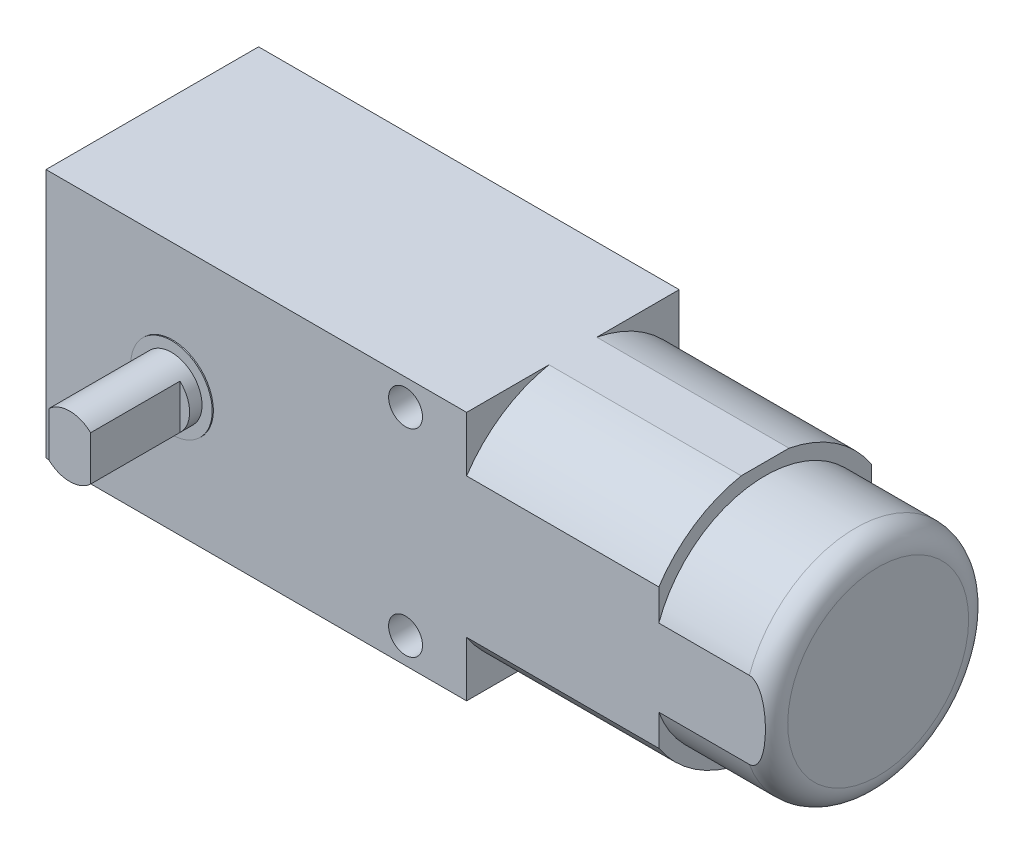
from build123d import *

# Parameters (mm, degrees)
SKETCH_2_W          = 18.8
SKETCH_2_H          = 22.1
EXTRUDE_1_DEPTH     = 64.2
SKETCH_4_R          = 3.6
EXTRUDE_2_DEPTH     = 0.1
SKETCH_5_R          = 2.7
EXTRUDE_3_DEPTH     = 9.1
CUT_EXTRUDE_START   = -7.9
CUT_EXTRUDE_1_DEPTH = 7.9
CUT_EXTRUDE_2_DEPTH = 27
CUT_EXTRUDE_3_DEPTH = 10
FILLET_1_R          = 2
SKETCH_10_R         = 1.5
CUT_EXTRUDE_4_DEPTH = 3


with BuildPart() as part:
    # 草图2 → 凸台-拉伸1 (new body)
    with BuildSketch(Plane(origin=(0, 0, 0), x_dir=(0, 0, -1), z_dir=(1, 0, 0))):
        Rectangle(SKETCH_2_W, SKETCH_2_H)
    extrude(amount=EXTRUDE_1_DEPTH)

    # 草图4 → 凸台-拉伸2 (add)
    with BuildSketch(Plane.XY.offset(9.4)):
        with Locations(Location((11.2, 0, 0), (0, 0, 180))):
            Circle(SKETCH_4_R)
    extrude(amount=EXTRUDE_2_DEPTH)

    # 草图5 → 凸台-拉伸3 (add)
    with BuildSketch(Plane.XY.offset(9.4)):
        with Locations(Location((11.2, 0, 0), (0, 0, 180))):
            Circle(SKETCH_5_R)
    extrude(amount=EXTRUDE_3_DEPTH)

    # 草图6 → 切除-拉伸1 (cut)
    with BuildSketch(Plane.XY.offset(18.5).offset(CUT_EXTRUDE_START)):
        with BuildLine():
            Line((9.35, -1.966596044), (9.35, 1.966596044))
            ThreePointArc((9.35, 1.966596044), (8.5, 0), (9.35, -1.966596044))
        make_face()
        with BuildLine():
            ThreePointArc((13.9, 0), (13.678406746, 1.071214264), (13.05, 1.966596044))
            Line((13.05, 1.966596044), (13.05, -1.966596044))
            ThreePointArc((13.05, -1.966596044), (13.678406746, -1.071214264), (13.9, 0))
        make_face()
    extrude(amount=CUT_EXTRUDE_1_DEPTH, mode=Mode.SUBTRACT)

    # 草图7 → 切除-拉伸2 (cut)
    with BuildSketch(Plane(origin=(64.2, 0, 0), x_dir=(0, 0, -1), z_dir=(1, 0, 0))):
        with BuildLine():
            ThreePointArc((-9.4, 6.180817098), (-6.249642407, 9.354382384), (-2.111871208, 11.05))
            Line((-2.111871208, 11.05), (-9.4, 11.05))
            Line((-9.4, 11.05), (-9.4, 6.180817098))
        make_face()
        with BuildLine():
            ThreePointArc((2.111871208, 11.05), (6.249642407, 9.354382384), (9.4, 6.180817098))
            Line((9.4, 6.180817098), (9.4, 11.05))
            Line((9.4, 11.05), (2.111871208, 11.05))
        make_face()
        with BuildLine():
            Line((2.111871208, -11.05), (9.4, -11.05))
            Line((9.4, -11.05), (9.4, -6.180817098))
            ThreePointArc((9.4, -6.180817098), (6.249642407, -9.354382384), (2.111871208, -11.05))
        make_face()
        with BuildLine():
            Line((-9.4, -11.05), (-2.111871208, -11.05))
            ThreePointArc((-2.111871208, -11.05), (-6.249642407, -9.354382384), (-9.4, -6.180817098))
            Line((-9.4, -6.180817098), (-9.4, -11.05))
        make_face()
    extrude(amount=-CUT_EXTRUDE_2_DEPTH, mode=Mode.SUBTRACT)

    # 草图9 → 切除-拉伸3 (cut)
    with BuildSketch(Plane(origin=(64.2, 0, 0), x_dir=(0, 0, -1), z_dir=(1, 0, 0))):
        with BuildLine():
            Line((-9.4, 6.180817098), (-9.4, 3.411744422))
            ThreePointArc((-9.4, 3.411744422), (0, 10), (9.4, 3.411744422))
            Line((9.4, 3.411744422), (9.4, 6.180817098))
            ThreePointArc((9.4, 6.180817098), (6.249642407, 9.354382384), (2.111871208, 11.05))
            Line((2.111871208, 11.05), (-2.111871208, 11.05))
            ThreePointArc((-2.111871208, 11.05), (-6.249642407, 9.354382384), (-9.4, 6.180817098))
        make_face()
        with BuildLine():
            ThreePointArc((-9.4, -6.180817098), (-6.249642407, -9.354382384), (-2.111871208, -11.05))
            Line((-2.111871208, -11.05), (2.111871208, -11.05))
            ThreePointArc((2.111871208, -11.05), (6.249642407, -9.354382384), (9.4, -6.180817098))
            Line((9.4, -6.180817098), (9.4, -3.411744422))
            ThreePointArc((9.4, -3.411744422), (0, -10), (-9.4, -3.411744422))
            Line((-9.4, -3.411744422), (-9.4, -6.180817098))
        make_face()
    extrude(amount=-CUT_EXTRUDE_3_DEPTH, mode=Mode.SUBTRACT)

    # 圆角1
    # the kernel refuses this fillet: 2 mm, written as the material it takes off along each edge
    with BuildSketch(Plane(origin=(64.2, 0, 0), x_dir=(0, -0.15173257370011314, 0.9884215831710372), z_dir=(0, -0.9884215831710372, -0.15173257370011314))) as fillet_1_piece_1:
        with BuildLine():
            CenterArc((10 - FILLET_1_R, FILLET_1_R), FILLET_1_R, 270, 90)
            Line((10 - FILLET_1_R, 0), (10, 0))
            Line((10, 0), (10, FILLET_1_R))
        make_face()
    revolve(axis=Axis((64.2, 0, 0), (-1, 0, 0)), revolution_arc=197.454690212, mode=Mode.SUBTRACT)
    with BuildSketch(Plane(origin=(64.2, 0, 0), x_dir=(0, 0.1517325737001477, -0.9884215831710319), z_dir=(0, 0.9884215831710319, 0.1517325737001477))) as fillet_1_piece_2:
        with BuildLine():
            CenterArc((10 - FILLET_1_R, FILLET_1_R), FILLET_1_R, 270, 90)
            Line((10, FILLET_1_R), (10, 0))
            Line((10, 0), (10 - FILLET_1_R, 0))
        make_face()
    revolve(axis=Axis((64.2, 0, 0), (-1, 0, 0)), revolution_arc=197.454690212, mode=Mode.SUBTRACT)

    # 草图10 → 切除-拉伸4 (cut)
    with BuildSketch(Plane.XY.offset(9.4)):
        with Locations((31.8, 8.75)):
            Circle(SKETCH_10_R)
        with Locations(Location((31.8, -8.75, 0), (0, 0, 180))):
            Circle(SKETCH_10_R)
    extrude(amount=-CUT_EXTRUDE_4_DEPTH, mode=Mode.SUBTRACT)


solid = part.part
